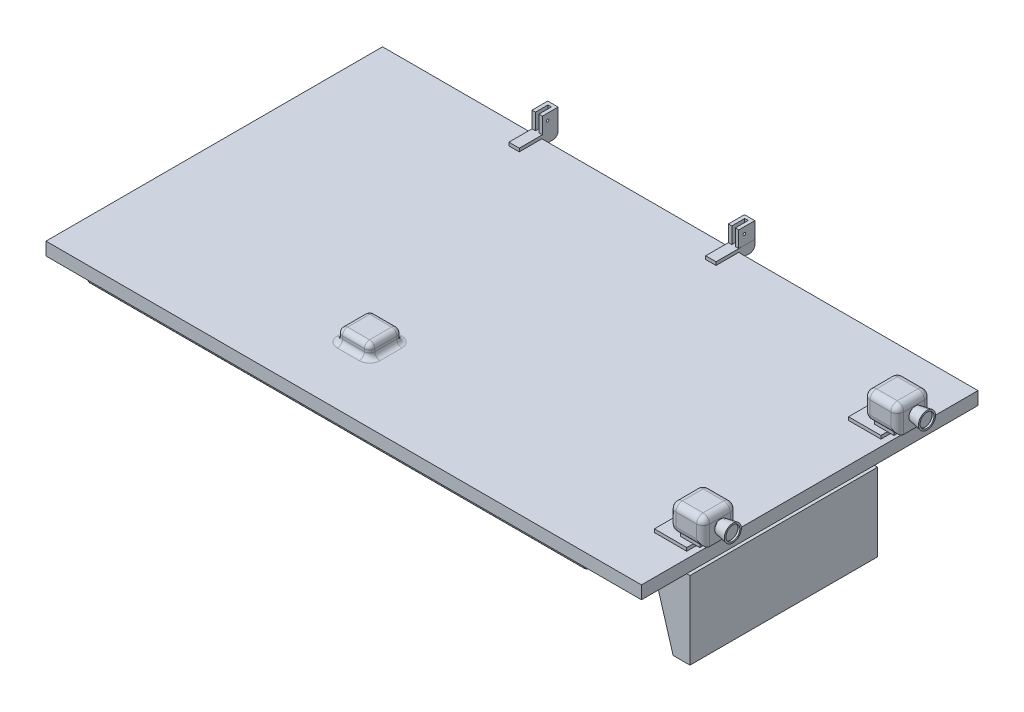
from build123d import *

# Parameters (mm, degrees)
SKETCH1_W                      = 920
SKETCH1_H                      = 520
BOSS_EXTRUDE1_DEPTH            = 20
SKETCH3_W                      = 770
SKETCH3_H                      = 470
SKETCH3_W_2                    = 750
SKETCH3_H_2                    = 450
BOSS_EXTRUDE2_DEPTH            = 30
SKETCH4_R                      = 25
CUT_EXTRUDE1_DEPTH             = 10
BOSS_EXTRUDE4_START            = 15
SKETCH6_R                      = 30
SKETCH6_R_2                    = 25
BOSS_EXTRUDE4_DEPTH            = 15
BOSS_EXTRUDE5_DEPTH            = 5
BOSS_EXTRUDE5_DEPTH_BACK       = 10
SKETCH7_W                      = 16
SKETCH7_H                      = 60
FILLET1_R                      = 8
BOSS_EXTRUDE6_DEPTH            = 25
SKETCH11_R                     = 2
CUT_EXTRUDE4_DEPTH             = 335
SKETCH12_W                     = 50
SKETCH12_H                     = 50
BOSS_EXTRUDE7_DEPTH            = 20
SKETCH14_W                     = 80
SKETCH14_H                     = 200
BOSS_EXTRUDE9_DEPTH            = 40
SKETCH15_W                     = 290
SKETCH15_H                     = 120
BOSS_EXTRUDE10_DEPTH           = 6
SKETCH16_W                     = 50
SKETCH16_H                     = 60
BOSS_EXTRUDE11_DEPTH           = 5
SKETCH17_W                     = 30
SKETCH17_H                     = 40
BOSS_EXTRUDE12_DEPTH           = 5
SKETCH18_W                     = 52
SKETCH18_H                     = 52
BOSS_EXTRUDE13_DEPTH           = 40
SKETCH19_R                     = 7.5
BOSS_EXTRUDE14_DEPTH           = 2
SKETCH20_R                     = 10
BOSS_EXTRUDE15_DEPTH           = 18
BOSS_EXTRUDE15_DRAFT           = -10
BOSS_EXTRUDE15_PROFILE_2_DEPTH = 18
BOSS_EXTRUDE15_PROFILE_2_DRAFT = -10
BOSS_EXTRUDE16_DEPTH           = 289
SKETCH22_W                     = 43.849543054
SKETCH22_H                     = 40
BOSS_EXTRUDE17_DEPTH           = 110
FILLET2_R                      = 10
SKETCH23_R                     = 10.736339639
CUT_EXTRUDE5_DEPTH             = 3
FILLET4_R                      = 8
FILLET12_R                     = 5


# Some blends are built 0.0001 mm under size
with BuildPart() as part:
    # Sketch1 → Boss-Extrude1 (new body)
    with BuildSketch(Plane(origin=(0, 0, 0), x_dir=(1, 0, 0), z_dir=(0, 1, 0))):
        with Locations((-30.234144718, 0)):
            Rectangle(SKETCH1_W, SKETCH1_H)
    extrude(amount=BOSS_EXTRUDE1_DEPTH)

    # Sketch3 → Boss-Extrude2 (add)
    with BuildSketch(Plane.XZ):
        with Locations((-65.234144718, 0)):
            Rectangle(SKETCH3_W, SKETCH3_H)
        with Locations((-65.234144718, 0)):
            Rectangle(SKETCH3_W_2, SKETCH3_H_2, mode=Mode.SUBTRACT)
    extrude(amount=BOSS_EXTRUDE2_DEPTH)

    # Sketch4 → Cut-Extrude1 (cut)
    with BuildSketch(Plane(origin=(0, 0, 0), x_dir=(-1, 0, 0), z_dir=(0, -1, 0))):
        with Locations(Location((-239.765855282, 0, 0), (0, 0, 90))):
            Circle(SKETCH4_R)
        with Locations(Location((300.234144718, -175, 0), (0, 0, 90))):
            Circle(SKETCH4_R)
        with Locations(Location((300.234144718, 175, 0), (0, 0, 90))):
            Circle(SKETCH4_R)
    extrude(amount=-CUT_EXTRUDE1_DEPTH, mode=Mode.SUBTRACT)

    # Sketch6 → Boss-Extrude4 (add)
    # profile 1 of 3: a face of its own
    with BuildSketch(Plane.XZ.offset(-10).offset(BOSS_EXTRUDE4_START)):
        with Locations(Location((239.765855282, 0, 0), (0, 0, 270))):
            Circle(SKETCH6_R)
        with Locations(Location((239.765855282, 0, 0), (0, 0, 270))):
            Circle(SKETCH6_R_2, mode=Mode.SUBTRACT)
    # profile 2 of 3: a face of its own
    with BuildSketch(Plane.XZ.offset(-10).offset(BOSS_EXTRUDE4_START)):
        with Locations(Location((-300.234144718, 175, 0), (0, 0, 270))):
            Circle(SKETCH6_R)
        with Locations(Location((-300.234144718, 175, 0), (0, 0, 270))):
            Circle(SKETCH6_R_2, mode=Mode.SUBTRACT)
    # profile 3 of 3: a face of its own
    with BuildSketch(Plane.XZ.offset(-10).offset(BOSS_EXTRUDE4_START)):
        with Locations(Location((-300.234144718, -175, 0), (0, 0, 270))):
            Circle(SKETCH6_R)
        with Locations(Location((-300.234144718, -175, 0), (0, 0, 270))):
            Circle(SKETCH6_R_2, mode=Mode.SUBTRACT)
    extrude(amount=-BOSS_EXTRUDE4_DEPTH)

    # Sketch7 → Boss-Extrude5 (add, two sides: drawn at the far end of the back side and taken through both)
    with BuildSketch(Plane(origin=(0, 20, 0), x_dir=(1, 0, 0), z_dir=(0, 1, 0)).offset(-BOSS_EXTRUDE5_DEPTH_BACK)):
        with Locations((52, 255)):
            Rectangle(SKETCH7_W, SKETCH7_H)
        with Locations((-252, 255)):
            Rectangle(SKETCH7_W, SKETCH7_H)
    extrude(amount=BOSS_EXTRUDE5_DEPTH + BOSS_EXTRUDE5_DEPTH_BACK)

    # Fillet1
    fillet1_edges = [part.edges().sort_by_distance(p)[0] for p in [
        (52, 10, -285),
        (-252, 10, -285),
    ]]
    fillet(fillet1_edges, radius=FILLET1_R)

    # Sketch10 → Boss-Extrude6 (add)
    with BuildSketch(Plane(origin=(0, 25, 0), x_dir=(1, 0, 0), z_dir=(0, 1, 0))):
        Polygon((-249.3, 280.02821074), (-249.3, 260.701383373), (-244, 260.701383373), (-244, 285), (-249.829734326, 285), (-254.569462673, 285), (-260, 285), (-260, 260.701383373), (-254.7, 260.701383373), (-254.7, 280.02821074), align=None)
        Polygon((43.945144154, 260.160918315), (43.945144154, 285.016383939), (60.006667616, 285.016383939), (59.945144154, 260.160918315), (54.645144154, 260.160918315), (54.645144154, 280.044594679), (49.245144154, 280.044594679), (49.245144154, 260.160918315), align=None)
    extrude(amount=BOSS_EXTRUDE6_DEPTH)

    # Sketch11 → Cut-Extrude4 (cut)
    with BuildSketch(Plane.ZY.offset(260)):
        with Locations((-268.701383373, 40)):
            Circle(SKETCH11_R)
    extrude(amount=-CUT_EXTRUDE4_DEPTH, mode=Mode.SUBTRACT)

    # Sketch12 → Boss-Extrude7 (add)
    with BuildSketch(Plane(origin=(0, 20, 0), x_dir=(1, 0, 0), z_dir=(0, 1, 0))):
        with Locations((-105.234144718, -145)):
            Rectangle(SKETCH12_W, SKETCH12_H)
    extrude(amount=BOSS_EXTRUDE7_DEPTH)

    # Sketch14 → Boss-Extrude9 (add)
    with BuildSketch(Plane.XZ):
        with Locations((388.705725542, 0)):
            Rectangle(SKETCH14_W, SKETCH14_H)
    extrude(amount=BOSS_EXTRUDE9_DEPTH)

    # Sketch15 → Boss-Extrude10 (add)
    with BuildSketch(Plane(origin=(428.705725542, 0, 0), x_dir=(0, 0, -1), z_dir=(1, 0, 0))):
        with Locations((-45, -60)):
            Rectangle(SKETCH15_W, SKETCH15_H)
    extrude(amount=BOSS_EXTRUDE10_DEPTH)

    # Sketch16 → Boss-Extrude11 (add)
    with BuildSketch(Plane(origin=(0, 20, 0), x_dir=(1, 0, 0), z_dir=(0, 1, 0))):
        with Locations((394.765855282, -150)):
            Rectangle(SKETCH16_W, SKETCH16_H)
        with Locations((394.765855282, 150)):
            Rectangle(SKETCH16_W, SKETCH16_H)
    extrude(amount=BOSS_EXTRUDE11_DEPTH)

    # Sketch17 → Boss-Extrude12 (add)
    with BuildSketch(Plane(origin=(0, 25, 0), x_dir=(1, 0, 0), z_dir=(0, 1, 0))):
        with Locations((415, -150)):
            Rectangle(SKETCH17_W, SKETCH17_H)
        with Locations((415, 150)):
            Rectangle(SKETCH17_W, SKETCH17_H)
    extrude(amount=BOSS_EXTRUDE12_DEPTH)

    # Sketch18 → Boss-Extrude13 (add)
    with BuildSketch(Plane(origin=(0, 30, 0), x_dir=(1, 0, 0), z_dir=(0, 1, 0))):
        with Locations((415, 150)):
            Rectangle(SKETCH18_W, SKETCH18_H)
        with Locations((415, -150)):
            Rectangle(SKETCH18_W, SKETCH18_H)
    extrude(amount=BOSS_EXTRUDE13_DEPTH)

    # Sketch19 → Boss-Extrude14 (add)
    with BuildSketch(Plane(origin=(441, 0, 0), x_dir=(0, 0, -1), z_dir=(1, 0, 0))):
        with Locations((-150, 51)):
            Circle(SKETCH19_R)
        with Locations((150, 51)):
            Circle(SKETCH19_R)
    extrude(amount=BOSS_EXTRUDE14_DEPTH)


with BuildPart() as boss_extrude15_tool:
    # Sketch20 → Boss-Extrude15 (with draft: the straight prism first)
    with BuildSketch(Plane(origin=(443, 0, 0), x_dir=(0, 0, -1), z_dir=(1, 0, 0))):
        with Locations((-150, 50)):
            Circle(SKETCH20_R)
    extrude(amount=BOSS_EXTRUDE15_DEPTH)
    # Boss-Extrude15: the draft: its side faces are tilted about the plane it starts from
    boss_extrude15_sides = [boss_extrude15_tool.faces().sort_by_distance(p)[0] for p in [
        (452, 50, 160),
    ]]
    draft(boss_extrude15_sides, Plane(origin=(443, 0, 0), x_dir=(0, 0, -1), z_dir=(1, 0, 0)), BOSS_EXTRUDE15_DRAFT)


with BuildPart() as part_1:
    add(part.part)

    # Boss-Extrude15: add boss_extrude15_tool
    add(boss_extrude15_tool.part)


with BuildPart() as boss_extrude15_profile_2_tool:
    # Sketch20 → Boss-Extrude15 profile 2 (with draft: the straight prism first)
    with BuildSketch(Plane(origin=(443, 0, 0), x_dir=(0, 0, -1), z_dir=(1, 0, 0))):
        with Locations((150, 51)):
            Circle(SKETCH20_R)
    extrude(amount=BOSS_EXTRUDE15_PROFILE_2_DEPTH)
    # Boss-Extrude15 profile 2: the draft: its side faces are tilted about the plane it starts from
    boss_extrude15_profile_2_sides = [boss_extrude15_profile_2_tool.faces().sort_by_distance(p)[0] for p in [
        (452, 51, -140),
    ]]
    draft(boss_extrude15_profile_2_sides, Plane(origin=(443, 0, 0), x_dir=(0, 0, -1), z_dir=(1, 0, 0)), BOSS_EXTRUDE15_PROFILE_2_DRAFT)


with BuildPart() as part_2:
    add(part_1.part)

    # Boss-Extrude15 profile 2: add boss_extrude15_profile_2_tool
    add(boss_extrude15_profile_2_tool.part)

    # Sketch21 → Boss-Extrude16 (add)
    with BuildSketch(Plane.XY.offset(190)):
        Polygon((428.705725542, -120), (408.705725542, -120), (384.856182488, -40), (428.705725542, -40), align=None)
    extrude(amount=-BOSS_EXTRUDE16_DEPTH)

    # Sketch22 → Boss-Extrude17 (add)
    with BuildSketch(Plane.XY.offset(190)):
        with Locations((406.780954015, -20)):
            Rectangle(SKETCH22_W, SKETCH22_H)
    extrude(amount=-BOSS_EXTRUDE17_DEPTH)

    # Fillet2
    # the kernel refuses this fillet: 10 mm, written as the material it takes off along each edge
    with BuildSketch(Plane(origin=(399, 40, 134), x_dir=(0, 0, -1), z_dir=(0, -1, 0))) as fillet2_piece_1_section:
        Polygon((0, 0), (FILLET2_R * 1.02, 0), (FILLET2_R * 1.02, -FILLET2_R * 1.02), (0, -FILLET2_R * 1.02), align=None)
    fillet2_piece_1 = extrude(amount=FILLET2_R * 1.02, mode=Mode.PRIVATE)
    fillet2_piece_1 = fillet2_piece_1 - Plane(origin=(399, 40, 134), x_dir=(0.7071067811865475, 0, 0.7071067811865475), z_dir=(0, -1, 0)) * Sphere(FILLET2_R, mode=Mode.PRIVATE)
    add(fillet2_piece_1, mode=Mode.SUBTRACT)
    with BuildSketch(Plane(origin=(399, 40, 166), x_dir=(0, 0, 1), z_dir=(0, -1, 0))) as fillet2_piece_2_section:
        Polygon((0, 0), (FILLET2_R * 1.02, 0), (FILLET2_R * 1.02, FILLET2_R * 1.02), (0, FILLET2_R * 1.02), align=None)
    fillet2_piece_2 = extrude(amount=FILLET2_R * 1.02, mode=Mode.PRIVATE)
    fillet2_piece_2 = fillet2_piece_2 - Plane(origin=(399, 40, 166), x_dir=(0.7071067811865475, 0, -0.7071067811865475), z_dir=(0, -1, 0)) * Sphere(FILLET2_R, mode=Mode.PRIVATE)
    add(fillet2_piece_2, mode=Mode.SUBTRACT)
    with BuildSketch(Plane(origin=(431, 60, -134), x_dir=(0, 0, 1), z_dir=(1, 0, 0))) as fillet2_piece_3_section:
        Polygon((0, 0), (FILLET2_R * 1.02, 0), (FILLET2_R * 1.02, -FILLET2_R * 1.02), (0, -FILLET2_R * 1.02), align=None)
    fillet2_piece_3 = extrude(amount=FILLET2_R * 1.02, mode=Mode.PRIVATE)
    fillet2_piece_3 = fillet2_piece_3 - Plane(origin=(431, 60, -134), x_dir=(0, -0.7071067811865475, -0.7071067811865475), z_dir=(1, 0, 0)) * Sphere(FILLET2_R, mode=Mode.PRIVATE)
    add(fillet2_piece_3, mode=Mode.SUBTRACT)
    with BuildSketch(Plane(origin=(399, 40, -134), x_dir=(0, 0, 1), z_dir=(0, -1, 0))) as fillet2_piece_4_section:
        Polygon((0, 0), (FILLET2_R * 1.02, 0), (FILLET2_R * 1.02, FILLET2_R * 1.02), (0, FILLET2_R * 1.02), align=None)
    fillet2_piece_4 = extrude(amount=FILLET2_R * 1.02, mode=Mode.PRIVATE)
    fillet2_piece_4 = fillet2_piece_4 - Plane(origin=(399, 40, -134), x_dir=(0.7071067811865475, 0, -0.7071067811865475), z_dir=(0, -1, 0)) * Sphere(FILLET2_R, mode=Mode.PRIVATE)
    add(fillet2_piece_4, mode=Mode.SUBTRACT)
    with BuildSketch(Plane(origin=(399, 60, -134), x_dir=(-1, 0, 0), z_dir=(0, 0, 1))) as fillet2_piece_5_section:
        Polygon((0, 0), (FILLET2_R * 1.02, 0), (FILLET2_R * 1.02, -FILLET2_R * 1.02), (0, -FILLET2_R * 1.02), align=None)
    fillet2_piece_5 = extrude(amount=FILLET2_R * 1.02, mode=Mode.PRIVATE)
    fillet2_piece_5 = fillet2_piece_5 - Plane(origin=(399, 60, -134), x_dir=(0.7071067811865475, -0.7071067811865475, 0), z_dir=(0, 0, 1)) * Sphere(FILLET2_R, mode=Mode.PRIVATE)
    add(fillet2_piece_5, mode=Mode.SUBTRACT)
    with BuildSketch(Plane(origin=(399, 40, -166), x_dir=(0, 0, -1), z_dir=(0, -1, 0))) as fillet2_piece_6_section:
        Polygon((0, 0), (FILLET2_R * 1.02, 0), (FILLET2_R * 1.02, -FILLET2_R * 1.02), (0, -FILLET2_R * 1.02), align=None)
    fillet2_piece_6 = extrude(amount=FILLET2_R * 1.02, mode=Mode.PRIVATE)
    fillet2_piece_6 = fillet2_piece_6 - Plane(origin=(399, 40, -166), x_dir=(0.7071067811865475, 0, 0.7071067811865475), z_dir=(0, -1, 0)) * Sphere(FILLET2_R, mode=Mode.PRIVATE)
    add(fillet2_piece_6, mode=Mode.SUBTRACT)
    with BuildSketch(Plane(origin=(399, 60, -166), x_dir=(-1, 0, 0), z_dir=(0, 0, -1))) as fillet2_piece_7_section:
        Polygon((0, 0), (FILLET2_R * 1.02, 0), (FILLET2_R * 1.02, FILLET2_R * 1.02), (0, FILLET2_R * 1.02), align=None)
    fillet2_piece_7 = extrude(amount=FILLET2_R * 1.02, mode=Mode.PRIVATE)
    fillet2_piece_7 = fillet2_piece_7 - Plane(origin=(399, 60, -166), x_dir=(0.7071067811865475, -0.7071067811865475, 0), z_dir=(0, 0, -1)) * Sphere(FILLET2_R, mode=Mode.PRIVATE)
    add(fillet2_piece_7, mode=Mode.SUBTRACT)
    with BuildSketch(Plane(origin=(431, 60, -166), x_dir=(0, 0, -1), z_dir=(1, 0, 0))) as fillet2_piece_8_section:
        Polygon((0, 0), (FILLET2_R * 1.02, 0), (FILLET2_R * 1.02, FILLET2_R * 1.02), (0, FILLET2_R * 1.02), align=None)
    fillet2_piece_8 = extrude(amount=FILLET2_R * 1.02, mode=Mode.PRIVATE)
    fillet2_piece_8 = fillet2_piece_8 - Plane(origin=(431, 60, -166), x_dir=(0, -0.7071067811865475, 0.7071067811865475), z_dir=(1, 0, 0)) * Sphere(FILLET2_R, mode=Mode.PRIVATE)
    add(fillet2_piece_8, mode=Mode.SUBTRACT)
    with BuildSketch(Plane(origin=(399, 60, 134), x_dir=(0, 1, 0), z_dir=(0, 0, -1))) as fillet2_piece_9_section:
        Polygon((0, 0), (FILLET2_R * 1.02, 0), (FILLET2_R * 1.02, -FILLET2_R * 1.02), (0, -FILLET2_R * 1.02), align=None)
    fillet2_piece_9 = extrude(amount=FILLET2_R * 1.02, mode=Mode.PRIVATE)
    fillet2_piece_9 = fillet2_piece_9 - Plane(origin=(399, 60, 134), x_dir=(0.7071067811865475, -0.7071067811865475, 0), z_dir=(0, 0, -1)) * Sphere(FILLET2_R, mode=Mode.PRIVATE)
    add(fillet2_piece_9, mode=Mode.SUBTRACT)
    with BuildSketch(Plane(origin=(399, 60, 166), x_dir=(0, 1, 0), z_dir=(0, 0, 1))) as fillet2_piece_10_section:
        Polygon((0, 0), (FILLET2_R * 1.02, 0), (FILLET2_R * 1.02, FILLET2_R * 1.02), (0, FILLET2_R * 1.02), align=None)
    fillet2_piece_10 = extrude(amount=FILLET2_R * 1.02, mode=Mode.PRIVATE)
    fillet2_piece_10 = fillet2_piece_10 - Plane(origin=(399, 60, 166), x_dir=(0.7071067811865475, -0.7071067811865475, 0), z_dir=(0, 0, 1)) * Sphere(FILLET2_R, mode=Mode.PRIVATE)
    add(fillet2_piece_10, mode=Mode.SUBTRACT)
    with BuildSketch(Plane(origin=(431, 60, 166), x_dir=(0, 1, 0), z_dir=(0, 0, 1))) as fillet2_piece_11_section:
        Polygon((0, 0), (FILLET2_R * 1.02, 0), (FILLET2_R * 1.02, -FILLET2_R * 1.02), (0, -FILLET2_R * 1.02), align=None)
    fillet2_piece_11 = extrude(amount=FILLET2_R * 1.02, mode=Mode.PRIVATE)
    fillet2_piece_11 = fillet2_piece_11 - Plane(origin=(431, 60, 166), x_dir=(-0.7071067811865475, -0.7071067811865475, 0), z_dir=(0, 0, 1)) * Sphere(FILLET2_R, mode=Mode.PRIVATE)
    add(fillet2_piece_11, mode=Mode.SUBTRACT)
    with BuildSketch(Plane(origin=(431, 60, 134), x_dir=(0, 1, 0), z_dir=(0, 0, -1))) as fillet2_piece_12_section:
        Polygon((0, 0), (FILLET2_R * 1.02, 0), (FILLET2_R * 1.02, FILLET2_R * 1.02), (0, FILLET2_R * 1.02), align=None)
    fillet2_piece_12 = extrude(amount=FILLET2_R * 1.02, mode=Mode.PRIVATE)
    fillet2_piece_12 = fillet2_piece_12 - Plane(origin=(431, 60, 134), x_dir=(-0.7071067811865475, -0.7071067811865475, 0), z_dir=(0, 0, -1)) * Sphere(FILLET2_R, mode=Mode.PRIVATE)
    add(fillet2_piece_12, mode=Mode.SUBTRACT)
    with BuildSketch(Plane(origin=(389, 30, 134), x_dir=(1, 0, 0), z_dir=(0, 0, 1)), Plane(origin=(389, 70, -166), x_dir=(0, -1, 0), z_dir=(0, 0, 1)), Plane(origin=(441, 70, -134), x_dir=(0, -1, 0), z_dir=(0, 0, -1)), Plane(origin=(431, 70, -176), x_dir=(0, -1, 0), z_dir=(-1, 0, 0)), Plane(origin=(399, 70, 176), x_dir=(0, -1, 0), z_dir=(1, 0, 0))) as fillet2_piece_13:
        with BuildLine():
            CenterArc((FILLET2_R, FILLET2_R), FILLET2_R, 180, 90)
            Line((0, FILLET2_R), (0, 0))
            Line((0, 0), (FILLET2_R, 0))
        make_face()
    extrude(amount=32, mode=Mode.SUBTRACT)
    with BuildSketch(Plane(origin=(441, 5, -124), x_dir=(0, 0, -1), z_dir=(0, 1, 0))) as fillet2_piece_14:
        with BuildLine():
            CenterArc((FILLET2_R, FILLET2_R), FILLET2_R, 180, 90)
            Line((0, FILLET2_R), (0, 0))
            Line((0, 0), (FILLET2_R, 0))
        make_face()
    extrude(amount=55, mode=Mode.SUBTRACT)
    with BuildSketch(Plane(origin=(399, 30, -124), x_dir=(0, 0, -1), z_dir=(1, 0, 0))) as fillet2_piece_15_section:
        with BuildLine():
            CenterArc((FILLET2_R, FILLET2_R), FILLET2_R, 180, 90)
            Line((0, FILLET2_R), (0, 0))
            Line((0, 0), (FILLET2_R, 0))
        make_face()
    fillet2_piece_15 = extrude(amount=67, mode=Mode.PRIVATE)
    fillet2_piece_15 = split(fillet2_piece_15, bisect_by=Plane(origin=(400, 30.248554445, -130.991460628), z_dir=(-1, 0, 0)), keep=Keep.TOP, mode=Mode.PRIVATE)
    add(fillet2_piece_15, mode=Mode.SUBTRACT)
    with BuildSketch(Plane(origin=(399, 30, -124), x_dir=(0, 0, -1), z_dir=(1, 0, 0))) as fillet2_piece_16_section:
        with BuildLine():
            CenterArc((FILLET2_R, FILLET2_R), FILLET2_R, 180, 90)
            Line((0, FILLET2_R), (0, 0))
            Line((0, 0), (FILLET2_R, 0))
        make_face()
    fillet2_piece_16 = extrude(amount=67, mode=Mode.PRIVATE)
    fillet2_piece_16 = split(fillet2_piece_16, bisect_by=Plane(origin=(415, 32.340298442, -130), z_dir=(0, 0, 1)), keep=Keep.TOP, mode=Mode.PRIVATE)
    add(fillet2_piece_16, mode=Mode.SUBTRACT)
    with BuildSketch(Plane(origin=(399, 30, -124), x_dir=(0, 0, -1), z_dir=(1, 0, 0))) as fillet2_piece_17_section:
        with BuildLine():
            CenterArc((FILLET2_R, FILLET2_R), FILLET2_R, 180, 90)
            Line((0, FILLET2_R), (0, 0))
            Line((0, 0), (FILLET2_R, 0))
        make_face()
    fillet2_piece_17 = extrude(amount=67, mode=Mode.PRIVATE)
    fillet2_piece_17 = split(fillet2_piece_17, bisect_by=Plane(origin=(430, 30.248554445, -130.991460628), z_dir=(1, 0, 0)), keep=Keep.TOP, mode=Mode.PRIVATE)
    add(fillet2_piece_17, mode=Mode.SUBTRACT)
    with BuildSketch(Plane(origin=(389, 40, -124), x_dir=(0, 0, -1), z_dir=(0, 1, 0)), Plane(origin=(389, 40, -176), x_dir=(1, 0, 0), z_dir=(0, 1, 0))) as fillet2_piece_18:
        with BuildLine():
            CenterArc((FILLET2_R, -FILLET2_R), FILLET2_R, 90, 90)
            Line((0, -FILLET2_R), (0, 0))
            Line((0, 0), (FILLET2_R, 0))
        make_face()
    extrude(amount=20, mode=Mode.SUBTRACT)
    with BuildSketch(Plane(origin=(389, 30, -166), x_dir=(0, 1, 0), z_dir=(0, 0, 1)), Plane(origin=(399, 70, -124), x_dir=(0, 0, -1), z_dir=(1, 0, 0)), Plane(origin=(389, 70, 134), x_dir=(1, 0, 0), z_dir=(0, 0, 1)), Plane(origin=(441, 70, 166), x_dir=(-1, 0, 0), z_dir=(0, 0, -1)), Plane(origin=(431, 70, 124), x_dir=(0, 0, 1), z_dir=(-1, 0, 0))) as fillet2_piece_19:
        with BuildLine():
            CenterArc((FILLET2_R, -FILLET2_R), FILLET2_R, 90, 90)
            Line((0, -FILLET2_R), (0, 0))
            Line((0, 0), (FILLET2_R, 0))
        make_face()
    extrude(amount=32, mode=Mode.SUBTRACT)
    with BuildSketch(Plane(origin=(441, 5, -176), x_dir=(0, 0, 1), z_dir=(0, 1, 0)), Plane(origin=(441, 5, 124), x_dir=(0, 0, 1), z_dir=(0, 1, 0)), Plane(origin=(441, 5, 176), x_dir=(-1, 0, 0), z_dir=(0, 1, 0))) as fillet2_piece_20:
        with BuildLine():
            CenterArc((FILLET2_R, -FILLET2_R), FILLET2_R, 90, 90)
            Line((0, -FILLET2_R), (0, 0))
            Line((0, 0), (FILLET2_R, 0))
        make_face()
    extrude(amount=55, mode=Mode.SUBTRACT)
    with BuildSketch(Plane(origin=(466, 30, -176), x_dir=(0, 1, 0), z_dir=(-1, 0, 0))) as fillet2_piece_21_section:
        with BuildLine():
            CenterArc((FILLET2_R, -FILLET2_R), FILLET2_R, 90, 90)
            Line((0, -FILLET2_R), (0, 0))
            Line((0, 0), (FILLET2_R, 0))
        make_face()
    fillet2_piece_21 = extrude(amount=67, mode=Mode.PRIVATE)
    fillet2_piece_21 = split(fillet2_piece_21, bisect_by=Plane(origin=(435.5, 32.340298442, -170), z_dir=(0, 0, -1)), keep=Keep.TOP, mode=Mode.PRIVATE)
    add(fillet2_piece_21, mode=Mode.SUBTRACT)
    with BuildSketch(Plane(origin=(466, 30, -176), x_dir=(0, 1, 0), z_dir=(-1, 0, 0))) as fillet2_piece_22_section:
        with BuildLine():
            CenterArc((FILLET2_R, -FILLET2_R), FILLET2_R, 90, 90)
            Line((0, -FILLET2_R), (0, 0))
            Line((0, 0), (FILLET2_R, 0))
        make_face()
    fillet2_piece_22 = extrude(amount=67, mode=Mode.PRIVATE)
    fillet2_piece_22 = split(fillet2_piece_22, bisect_by=Plane(origin=(430, 30.248554445, -169.008539372), z_dir=(1, 0, 0)), keep=Keep.TOP, mode=Mode.PRIVATE)
    add(fillet2_piece_22, mode=Mode.SUBTRACT)
    with BuildSketch(Plane(origin=(466, 30, -176), x_dir=(0, 1, 0), z_dir=(-1, 0, 0))) as fillet2_piece_23_section:
        with BuildLine():
            CenterArc((FILLET2_R, -FILLET2_R), FILLET2_R, 90, 90)
            Line((0, -FILLET2_R), (0, 0))
            Line((0, 0), (FILLET2_R, 0))
        make_face()
    fillet2_piece_23 = extrude(amount=67, mode=Mode.PRIVATE)
    fillet2_piece_23 = split(fillet2_piece_23, bisect_by=Plane(origin=(400, 30.248554445, -169.008539372), z_dir=(-1, 0, 0)), keep=Keep.TOP, mode=Mode.PRIVATE)
    add(fillet2_piece_23, mode=Mode.SUBTRACT)
    with BuildSketch(Plane(origin=(389, 40, 124), x_dir=(0, 0, 1), z_dir=(0, 1, 0)), Plane(origin=(389, 40, 176), x_dir=(1, 0, 0), z_dir=(0, 1, 0))) as fillet2_piece_24:
        with BuildLine():
            CenterArc((FILLET2_R, FILLET2_R), FILLET2_R, 180, 90)
            Line((0, FILLET2_R), (0, 0))
            Line((0, 0), (FILLET2_R, 0))
        make_face()
    extrude(amount=20, mode=Mode.SUBTRACT)
    with BuildSketch(Plane(origin=(466, 30, 124), x_dir=(0, 0, 1), z_dir=(-1, 0, 0))) as fillet2_piece_25_section:
        with BuildLine():
            CenterArc((FILLET2_R, FILLET2_R), FILLET2_R, 180, 90)
            Line((0, FILLET2_R), (0, 0))
            Line((0, 0), (FILLET2_R, 0))
        make_face()
    fillet2_piece_25 = extrude(amount=67, mode=Mode.PRIVATE)
    fillet2_piece_25 = split(fillet2_piece_25, bisect_by=Plane(origin=(430, 30.248554445, 130.991460628), z_dir=(1, 0, 0)), keep=Keep.TOP, mode=Mode.PRIVATE)
    add(fillet2_piece_25, mode=Mode.SUBTRACT)
    with BuildSketch(Plane(origin=(466, 30, 124), x_dir=(0, 0, 1), z_dir=(-1, 0, 0))) as fillet2_piece_26_section:
        with BuildLine():
            CenterArc((FILLET2_R, FILLET2_R), FILLET2_R, 180, 90)
            Line((0, FILLET2_R), (0, 0))
            Line((0, 0), (FILLET2_R, 0))
        make_face()
    fillet2_piece_26 = extrude(amount=67, mode=Mode.PRIVATE)
    fillet2_piece_26 = split(fillet2_piece_26, bisect_by=Plane(origin=(415, 32.340298442, 130), z_dir=(0, 0, -1)), keep=Keep.TOP, mode=Mode.PRIVATE)
    add(fillet2_piece_26, mode=Mode.SUBTRACT)
    with BuildSketch(Plane(origin=(466, 30, 124), x_dir=(0, 0, 1), z_dir=(-1, 0, 0))) as fillet2_piece_27_section:
        with BuildLine():
            CenterArc((FILLET2_R, FILLET2_R), FILLET2_R, 180, 90)
            Line((0, FILLET2_R), (0, 0))
            Line((0, 0), (FILLET2_R, 0))
        make_face()
    fillet2_piece_27 = extrude(amount=67, mode=Mode.PRIVATE)
    fillet2_piece_27 = split(fillet2_piece_27, bisect_by=Plane(origin=(400, 30.248554445, 130.991460628), z_dir=(-1, 0, 0)), keep=Keep.TOP, mode=Mode.PRIVATE)
    add(fillet2_piece_27, mode=Mode.SUBTRACT)
    with BuildSketch(Plane(origin=(399, 30, 176), x_dir=(0, 0, -1), z_dir=(1, 0, 0))) as fillet2_piece_28_section:
        with BuildLine():
            CenterArc((FILLET2_R, FILLET2_R), FILLET2_R, 180, 90)
            Line((0, FILLET2_R), (0, 0))
            Line((0, 0), (FILLET2_R, 0))
        make_face()
    fillet2_piece_28 = extrude(amount=67, mode=Mode.PRIVATE)
    fillet2_piece_28 = split(fillet2_piece_28, bisect_by=Plane(origin=(400, 30.248554445, 169.008539372), z_dir=(-1, 0, 0)), keep=Keep.TOP, mode=Mode.PRIVATE)
    add(fillet2_piece_28, mode=Mode.SUBTRACT)
    with BuildSketch(Plane(origin=(399, 30, 176), x_dir=(0, 0, -1), z_dir=(1, 0, 0))) as fillet2_piece_29_section:
        with BuildLine():
            CenterArc((FILLET2_R, FILLET2_R), FILLET2_R, 180, 90)
            Line((0, FILLET2_R), (0, 0))
            Line((0, 0), (FILLET2_R, 0))
        make_face()
    fillet2_piece_29 = extrude(amount=67, mode=Mode.PRIVATE)
    fillet2_piece_29 = split(fillet2_piece_29, bisect_by=Plane(origin=(415, 32.340298442, 170), z_dir=(0, 0, 1)), keep=Keep.TOP, mode=Mode.PRIVATE)
    add(fillet2_piece_29, mode=Mode.SUBTRACT)
    with BuildSketch(Plane(origin=(399, 30, 176), x_dir=(0, 0, -1), z_dir=(1, 0, 0))) as fillet2_piece_30_section:
        with BuildLine():
            CenterArc((FILLET2_R, FILLET2_R), FILLET2_R, 180, 90)
            Line((0, FILLET2_R), (0, 0))
            Line((0, 0), (FILLET2_R, 0))
        make_face()
    fillet2_piece_30 = extrude(amount=67, mode=Mode.PRIVATE)
    fillet2_piece_30 = split(fillet2_piece_30, bisect_by=Plane(origin=(430, 30.248554445, 169.008539372), z_dir=(1, 0, 0)), keep=Keep.TOP, mode=Mode.PRIVATE)
    add(fillet2_piece_30, mode=Mode.SUBTRACT)

    # Sketch23 → Cut-Extrude5 (cut)
    with BuildSketch(Plane(origin=(461, 0, 0), x_dir=(0, 0, -1), z_dir=(1, 0, 0))):
        with Locations((-150, 50)):
            Circle(SKETCH23_R)
        with Locations((150, 51)):
            Circle(SKETCH23_R)
    extrude(amount=-CUT_EXTRUDE5_DEPTH, mode=Mode.SUBTRACT)

    # Fillet4
    fillet4_edges = [part_2.edges().sort_by_distance(p)[0] for p in [
        (-130.234144718, 20, 145),
        (-130.234144718, 30, 120),
        (-105.234144718, 20, 170),
        (-130.234144718, 30, 170),
        (-80.234144718, 20, 145),
        (-80.234144718, 30, 170),
        (-105.234144718, 20, 120),
        (-80.234144718, 30, 120),
        (-130.234144718, 40, 145),
        (-105.234144718, 40, 170),
        (-80.234144718, 40, 145),
        (-105.234144718, 40, 120),
    ]]
    fillet(fillet4_edges, radius=FILLET4_R)

    # Fillet12
    fillet12_edges = [part_2.edges().sort_by_distance(p)[0] for p in [
        (319.765855282, -30, 0),
        (-65.234144718, -30, 235),
        (-450.234144718, -30, 0),
        (-65.234144718, -30, -235),
        (319.765855282, 0, 0),
        (319.765855282, -15, -235),
        (-65.234144718, 0, 235),
        (319.765855282, -15, 235),
        (-65.234144718, 0, -235),
        (309.765855282, -30, 0),
        (-65.234144718, -30, 225),
        (-440.234144718, -30, 0),
        (-65.234144718, -30, -225),
    ]]
    fillet(fillet12_edges, radius=FILLET12_R - 0.0001)  # a hair under: the kernel refuses the full size


solid = part_2.part
